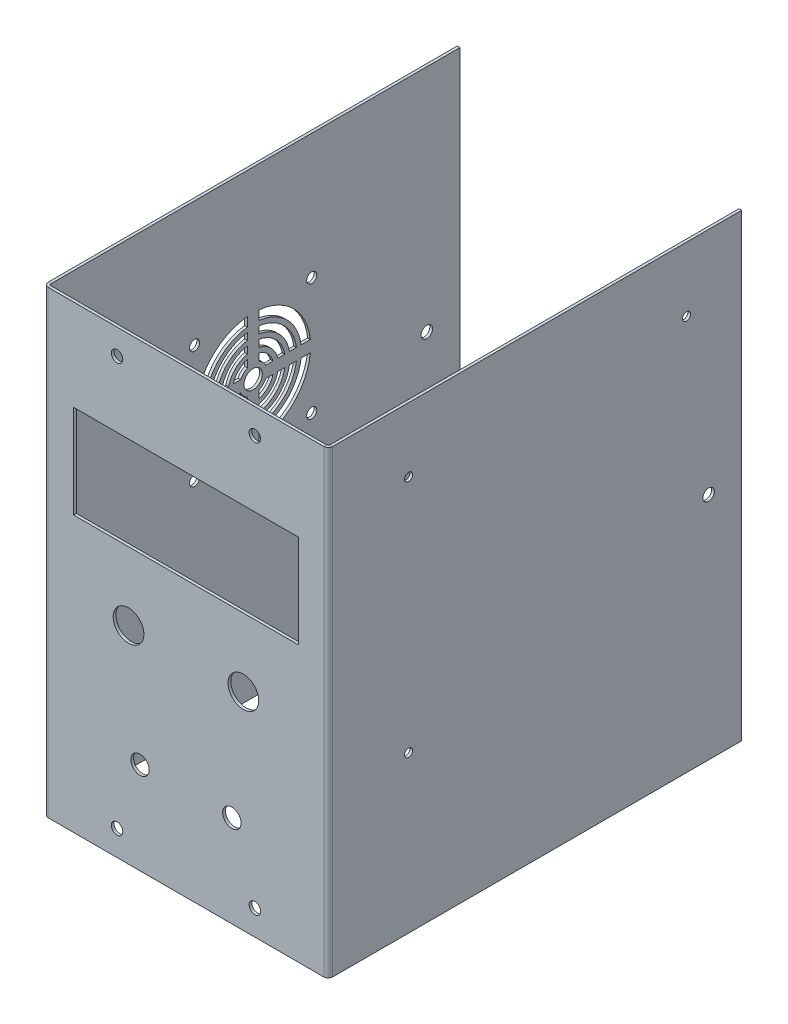
from build123d import *

# Parameters (mm, degrees)
SKETCH1_W               = 120
SKETCH1_H               = 200
BASE_FLANGE1_DEPTH      = 1.2
EDGE_FLANGE1_DEPTH      = 200
EDGE_FLANGE1_BEND_DEPTH = 200
VENT2_START             = -63
VENT2_DEPTH             = 3
SKETCH17_R              = 4
SKETCH17_R_2            = 6.68
CUT_EXTRUDE1_DEPTH      = 10
SKETCH18_R              = 2.5
CUT_EXTRUDE2_DEPTH      = 241.300998248
SKETCH19_R              = 2.5
CUT_EXTRUDE3_DEPTH      = 10
SKETCH20_R              = 2.2
CUT_EXTRUDE4_DEPTH      = 10
SKETCH21_W              = 97.8
SKETCH21_H              = 40.6
CUT_EXTRUDE5_DEPTH      = 10
SKETCH22_R              = 1.75
CUT_EXTRUDE6_DEPTH      = 10


with BuildPart() as part:
    # Base-Flange1: sheet metal written as solids
    # Sketch1 → Base-Flange1 (new body)
    with BuildSketch(Plane.XY):
        Rectangle(SKETCH1_W, SKETCH1_H)
    extrude(amount=-BASE_FLANGE1_DEPTH)

    # Edge-Flange1: sheet metal written as solids
    # Edge-Flange1 section (on a plane across the edge) → Edge-Flange1 (add)
    with BuildSketch(Plane(origin=(60.7366, 100, -1.2), x_dir=(-1, 0, 0), z_dir=(0, -1, 0))):
        with BuildLine():
            Line((-1.2, 0.7366), (-1.2, 178.8))
            Line((-1.2, 178.8), (0, 178.8))
            Line((0, 178.8), (0, 0.7366))
            ThreePointArc((0, 0.7366), (0.215745145, 0.215745145), (0.7366, 0))
            Line((0.7366, 0), (0.7366, -1.2))
            ThreePointArc((0.7366, -1.2), (-0.632782992, -0.632782992), (-1.2, 0.7366))
        make_face()
    extrude(amount=EDGE_FLANGE1_DEPTH)

    # Edge-Flange1 section 2 (on a plane across the edge) → Edge-Flange1 bend (add)
    with BuildSketch(Plane(origin=(-60.7366, -100, -1.2), x_dir=(1, 0, 0), z_dir=(0, 1, 0))):
        with BuildLine():
            Line((-1.2, 0.7366), (-1.2, 178.8))
            Line((-1.2, 178.8), (0, 178.8))
            Line((0, 178.8), (0, 0.7366))
            ThreePointArc((0, 0.7366), (0.215745145, 0.215745145), (0.7366, 0))
            Line((0.7366, 0), (0.7366, -1.2))
            ThreePointArc((0.7366, -1.2), (-0.632782992, -0.632782992), (-1.2, 0.7366))
        make_face()
    extrude(amount=EDGE_FLANGE1_BEND_DEPTH)

    # Vent2: read off the stored shape, not the designer's step
    # Vent2 outline → Vent2 (cut)
    with BuildSketch(Plane.YZ.offset(VENT2_START)):
        with BuildLine():
            add(Edge.make_bspline(
                [(22.499972366, -65.125409409), (23.297481433, -65.205558902), (25.711335631, -65.565787214), (29.628757098, -66.754124024), (33.97878866, -69.079264336), (37.791623213, -72.208376787), (40.920735664, -76.02121134), (43.245875976, -80.371242902), (44.43421289, -84.288664712), (44.794441203, -86.702519272), (44.874590698, -87.500028698)],
                knots=[0.015942024, 0.015942024, 0.015942024, 0.015942024, 0.03125, 0.0625, 0.09375, 0.125, 0.15625, 0.1875, 0.21875, 0.234057983, 0.234057983, 0.234057983, 0.234057983], degree=3))
            Line((22.499972366, -65.125409409), (22.499983292, -69.149413684))
            add(Edge.make_bspline(
                [(22.499983292, -69.149413684), (23.035288652, -69.213578954), (24.926509708, -69.514389274), (28.088155963, -70.47346418), (31.742182475, -72.426582042), (34.944963499, -75.055036501), (37.573417958, -78.257817525), (39.52653582, -81.911844037), (40.48561085, -85.073490703), (40.78642118, -86.964712193), (40.850586469, -87.50001798)],
                knots=[0.018991976, 0.018991976, 0.018991976, 0.018991976, 0.03125, 0.0625, 0.09375, 0.125, 0.15625, 0.1875, 0.21875, 0.231008033, 0.231008033, 0.231008033, 0.231008033], degree=3))
            Line((40.850586469, -87.50001798), (44.874590698, -87.500028698))
        make_face()
        with BuildLine():
            add(Edge.make_bspline(
                [(-4.87459069, -87.500028616), (-4.794441195, -86.702519218), (-4.434212882, -84.288664686), (-3.245875976, -80.371242902), (-0.920735664, -76.02121134), (2.208376787, -72.208376787), (6.02121134, -69.079264336), (10.371242902, -66.754124024), (14.288665029, -65.565787014), (16.702519925, -65.205558699), (17.500029681, -65.125409203)],
                knots=[0.765942017, 0.765942017, 0.765942017, 0.765942017, 0.78125, 0.8125, 0.84375, 0.875, 0.90625, 0.9375, 0.96875, 0.98405799, 0.98405799, 0.98405799, 0.98405799], degree=3))
            Line((-4.87459069, -87.500028616), (-0.850586389, -87.50001731))
            add(Edge.make_bspline(
                [(-0.850586389, -87.50001731), (-0.78642111, -86.964711748), (-0.485610785, -85.073490486), (0.47346418, -81.911844037), (2.426582042, -78.257817525), (5.055036501, -75.055036501), (8.257817525, -72.426582042), (11.911844037, -70.47346418), (15.073490897, -69.514389091), (16.964712592, -69.213578756), (17.500018583, -69.149413459)],
                knots=[0.768991972, 0.768991972, 0.768991972, 0.768991972, 0.78125, 0.8125, 0.84375, 0.875, 0.90625, 0.9375, 0.96875, 0.981008038, 0.981008038, 0.981008038, 0.981008038], degree=3))
            Line((17.500018583, -69.149413459), (17.500029681, -65.125409203))
        make_face()
        with BuildLine():
            add(Edge.make_bspline(
                [(17.500028616, -114.87459069), (16.702519218, -114.794441195), (14.288664686, -114.434212882), (10.371242902, -113.245875976), (6.02121134, -110.920735664), (2.208376787, -107.791623213), (-0.920735664, -103.97878866), (-3.245875976, -99.628757098), (-4.43421289, -95.711335288), (-4.794441203, -93.297480728), (-4.874590698, -92.499971302)],
                knots=[0.515942017, 0.515942017, 0.515942017, 0.515942017, 0.53125, 0.5625, 0.59375, 0.625, 0.65625, 0.6875, 0.71875, 0.734057983, 0.734057983, 0.734057983, 0.734057983], degree=3))
            Line((17.500028616, -114.87459069), (17.50001731, -110.850586388))
            add(Edge.make_bspline(
                [(17.50001731, -110.850586388), (16.964711748, -110.786421109), (15.073490486, -110.485610785), (11.911844037, -109.52653582), (8.257817525, -107.573417958), (5.055036501, -104.944963499), (2.426582042, -101.742182475), (0.47346418, -98.088155963), (-0.48561085, -94.926509297), (-0.78642118, -93.035287808), (-0.850586469, -92.49998202)],
                knots=[0.518991972, 0.518991972, 0.518991972, 0.518991972, 0.53125, 0.5625, 0.59375, 0.625, 0.65625, 0.6875, 0.71875, 0.731008033, 0.731008033, 0.731008033, 0.731008033], degree=3))
            Line((-0.850586469, -92.49998202), (-4.874590698, -92.499971302))
        make_face()
        with BuildLine():
            add(Edge.make_bspline(
                [(44.87459069, -92.499971384), (44.794441195, -93.297480782), (44.434212882, -95.711335314), (43.245875976, -99.628757098), (40.920735664, -103.97878866), (37.791623213, -107.791623213), (33.97878866, -110.920735664), (29.628757098, -113.245875976), (25.711335288, -114.43421289), (23.297480728, -114.794441203), (22.499971302, -114.874590698)],
                knots=[0.265942017, 0.265942017, 0.265942017, 0.265942017, 0.28125, 0.3125, 0.34375, 0.375, 0.40625, 0.4375, 0.46875, 0.484057983, 0.484057983, 0.484057983, 0.484057983], degree=3))
            Line((44.87459069, -92.499971384), (40.850586388, -92.49998269))
            add(Edge.make_bspline(
                [(40.850586388, -92.49998269), (40.786421109, -93.035288252), (40.485610785, -94.926509514), (39.52653582, -98.088155963), (37.573417958, -101.742182475), (34.944963499, -104.944963499), (31.742182475, -107.573417958), (28.088155963, -109.52653582), (24.926509297, -110.48561085), (23.035287808, -110.78642118), (22.49998202, -110.850586469)],
                knots=[0.268991972, 0.268991972, 0.268991972, 0.268991972, 0.28125, 0.3125, 0.34375, 0.375, 0.40625, 0.4375, 0.46875, 0.481008033, 0.481008033, 0.481008033, 0.481008033], degree=3))
            Line((22.49998202, -110.850586469), (22.499971302, -114.874590698))
        make_face()
        with BuildLine():
            Line((17.500019256, -98.64577847), (17.500009439, -95.454350713))
            add(Edge.make_bspline(
                [(17.500009439, -95.454350713), (17.210439413, -95.32160561), (16.58749433, -94.973708422), (15.730010429, -94.269989571), (15.026292586, -93.412506899), (14.678395937, -92.789563358), (14.545651265, -92.499994876)],
                knots=[0.568400752, 0.568400752, 0.568400752, 0.568400752, 0.59375, 0.625, 0.65625, 0.681599122, 0.681599122, 0.681599122, 0.681599122], degree=3))
            Line((14.545651265, -92.499994876), (11.354221815, -92.499981731))
            add(Edge.make_bspline(
                [(17.500019256, -98.64577847), (17.179491053, -98.553088512), (16.307327001, -98.247544554), (14.967636082, -97.531464839), (13.595015643, -96.404984357), (12.468535161, -95.032363918), (11.752455608, -93.692673302), (11.446911715, -92.820509595), (11.354221815, -92.499981731)],
                knots=[0.544798779, 0.544798779, 0.544798779, 0.544798779, 0.5625, 0.59375, 0.625, 0.65625, 0.6875, 0.705201203, 0.705201203, 0.705201203, 0.705201203], degree=3))
        make_face()
        with BuildLine():
            Line((11.35422153, -87.500019256), (14.545649288, -87.500009437))
            add(Edge.make_bspline(
                [(14.545649288, -87.500009437), (14.67839439, -87.210439412), (15.026291578, -86.587494329), (15.730010429, -85.730010429), (16.587493101, -85.026292586), (17.210436642, -84.678395937), (17.500005124, -84.545651265)],
                knots=[0.818400752, 0.818400752, 0.818400752, 0.818400752, 0.84375, 0.875, 0.90625, 0.931599122, 0.931599122, 0.931599122, 0.931599122], degree=3))
            Line((17.500005124, -84.545651265), (17.500018269, -81.354221815))
            add(Edge.make_bspline(
                [(11.35422153, -87.500019256), (11.446911488, -87.179491053), (11.752455446, -86.307327001), (12.468535161, -84.967636082), (13.595015643, -83.595015643), (14.967636082, -82.468535161), (16.307326698, -81.752455608), (17.179490405, -81.446911715), (17.500018269, -81.354221815)],
                knots=[0.794798779, 0.794798779, 0.794798779, 0.794798779, 0.8125, 0.84375, 0.875, 0.90625, 0.9375, 0.955201203, 0.955201203, 0.955201203, 0.955201203], degree=3))
        make_face()
        with BuildLine():
            Line((22.499980744, -81.35422153), (22.499990561, -84.545649287))
            add(Edge.make_bspline(
                [(22.499990561, -84.545649287), (22.789560587, -84.67839439), (23.41250567, -85.026291578), (24.269989571, -85.730010429), (24.973707413, -86.587493101), (25.321604062, -87.210436641), (25.454348735, -87.500005123)],
                knots=[0.068400752, 0.068400752, 0.068400752, 0.068400752, 0.09375, 0.125, 0.15625, 0.181599122, 0.181599122, 0.181599122, 0.181599122], degree=3))
            Line((25.454348735, -87.500005123), (28.645778185, -87.500018269))
            add(Edge.make_bspline(
                [(22.499980744, -81.35422153), (22.820508947, -81.446911488), (23.692672999, -81.752455446), (25.032363918, -82.468535161), (26.404984357, -83.595015643), (27.531464839, -84.967636082), (28.247544392, -86.307326698), (28.553088285, -87.179490405), (28.645778185, -87.500018269)],
                knots=[0.044798779, 0.044798779, 0.044798779, 0.044798779, 0.0625, 0.09375, 0.125, 0.15625, 0.1875, 0.205201203, 0.205201203, 0.205201203, 0.205201203], degree=3))
        make_face()
        with BuildLine():
            Line((28.64577847, -92.499980744), (25.454350713, -92.499990561))
            add(Edge.make_bspline(
                [(25.454350713, -92.499990561), (25.32160561, -92.789560587), (24.973708422, -93.41250567), (24.269989571, -94.269989571), (23.412506899, -94.973707414), (22.789563358, -95.321604063), (22.499994876, -95.454348735)],
                knots=[0.318400752, 0.318400752, 0.318400752, 0.318400752, 0.34375, 0.375, 0.40625, 0.431599122, 0.431599122, 0.431599122, 0.431599122], degree=3))
            Line((22.499994876, -95.454348735), (22.499981731, -98.645778185))
            add(Edge.make_bspline(
                [(28.64577847, -92.499980744), (28.553088512, -92.820508947), (28.247544554, -93.692672999), (27.531464839, -95.032363918), (26.404984357, -96.404984357), (25.032363918, -97.531464839), (23.692673302, -98.247544392), (22.820509595, -98.553088285), (22.499981731, -98.645778185)],
                knots=[0.294798779, 0.294798779, 0.294798779, 0.294798779, 0.3125, 0.34375, 0.375, 0.40625, 0.4375, 0.455201203, 0.455201203, 0.455201203, 0.455201203], degree=3))
        make_face()
        with BuildLine():
            add(Edge.make_bspline(
                [(20, -86), (20.261846381, -86.000014529), (20.785624316, -86.050145571), (21.540195996, -86.281273396), (22.237350899, -86.651395328), (22.846013213, -87.153723892), (23.348500118, -87.762487499), (23.718595562, -88.459506482), (23.949869823, -89.21422335), (24.02505564, -89.999814526), (23.949907601, -90.785586765), (23.718737499, -91.540150756), (23.348607749, -92.237351731), (22.846275284, -92.84601299), (22.237512722, -93.348500178), (21.540493459, -93.718595546), (20.785776666, -93.949869827), (20.00018547, -94.025055639), (19.214413236, -93.949907601), (18.459849244, -93.718737499), (17.76264827, -93.348607749), (17.15398701, -92.846275284), (16.651499822, -92.237512722), (16.281404454, -91.540493459), (16.050130172, -90.785776665), (15.974944362, -90.000185474), (16.050092394, -89.21441322), (16.281262517, -88.459849303), (16.651392191, -87.762648048), (17.153724939, -87.153987836), (17.762486446, -86.65149674), (18.459551818, -86.281393571), (19.214260901, -86.050076915), (19.738058598, -85.999985466), (20, -86)],
                knots=[0, 0, 0, 0, 0.031244329, 0.06249978, 0.093738662, 0.12499978, 0.156238662, 0.18749978, 0.218738662, 0.24999978, 0.281238662, 0.31249978, 0.343738662, 0.37499978, 0.406238662, 0.43749978, 0.468738662, 0.49999978, 0.531238662, 0.56249978, 0.593738662, 0.62499978, 0.656238662, 0.68749978, 0.718738662, 0.74999978, 0.781238662, 0.81249978, 0.843738662, 0.87499978, 0.906238662, 0.93749978, 0.968744333, 1, 1, 1, 1], degree=3))
        make_face()
        with BuildLine():
            Line((22.5, -76.22502813), (22.499992808, -79.287869419))
            add(Edge.make_bspline(
                [(22.499992808, -79.287869419), (23.083519109, -79.424088892), (24.343642182, -79.829001414), (26.150667011, -80.794876308), (27.828314214, -82.171685786), (29.205123692, -83.849332989), (30.170998215, -85.656357123), (30.575910627, -86.916479393), (30.712130047, -87.500004902)],
                knots=[0.036490414, 0.036490414, 0.036490414, 0.036490414, 0.0625, 0.09375, 0.125, 0.15625, 0.1875, 0.213509552, 0.213509552, 0.213509552, 0.213509552], degree=3))
            Line((30.712130047, -87.500004902), (33.77497187, -87.5))
            add(Edge.make_bspline(
                [(22.5, -76.22502813), (22.577209923, -76.239037558), (23.554493564, -76.42487643), (25.392103975, -76.982309454), (27.82812165, -78.284388028), (29.963309, -80.036691), (31.715611972, -82.17187835), (33.017690546, -84.607896025), (33.57512357, -86.445506436), (33.760962442, -87.422790077), (33.77497187, -87.5)],
                knots=[0.02857377, 0.02857377, 0.02857377, 0.02857377, 0.03125, 0.0625, 0.09375, 0.125, 0.15625, 0.1875, 0.21875, 0.22142623, 0.22142623, 0.22142623, 0.22142623], degree=3))
        make_face()
        with BuildLine():
            Line((33.77497187, -92.5), (30.712130581, -92.499992808))
            add(Edge.make_bspline(
                [(30.712130581, -92.499992808), (30.575911108, -93.083519109), (30.170998586, -94.343642182), (29.205123692, -96.150667011), (27.828314214, -97.828314214), (26.150667011, -99.205123692), (24.343642877, -100.170998215), (23.083520607, -100.575910627), (22.499995098, -100.712130047)],
                knots=[0.286490414, 0.286490414, 0.286490414, 0.286490414, 0.3125, 0.34375, 0.375, 0.40625, 0.4375, 0.463509552, 0.463509552, 0.463509552, 0.463509552], degree=3))
            Line((22.499995098, -100.712130047), (22.5, -103.77497187))
            add(Edge.make_bspline(
                [(33.77497187, -92.5), (33.760962442, -92.577209923), (33.57512357, -93.554493564), (33.017690546, -95.392103975), (31.715611972, -97.82812165), (29.963309, -99.963309), (27.82812165, -101.715611972), (25.392103975, -103.017690546), (23.554493564, -103.57512357), (22.577209923, -103.760962442), (22.5, -103.77497187)],
                knots=[0.27857377, 0.27857377, 0.27857377, 0.27857377, 0.28125, 0.3125, 0.34375, 0.375, 0.40625, 0.4375, 0.46875, 0.47142623, 0.47142623, 0.47142623, 0.47142623], degree=3))
        make_face()
        with BuildLine():
            Line((6.22502813, -87.5), (9.287869419, -87.500007192))
            add(Edge.make_bspline(
                [(9.287869419, -87.500007192), (9.424088892, -86.916480891), (9.829001414, -85.656357818), (10.794876308, -83.849332989), (12.171685786, -82.171685786), (13.849332989, -80.794876308), (15.656357123, -79.829001785), (16.916479393, -79.424089373), (17.500004902, -79.287869953)],
                knots=[0.786490414, 0.786490414, 0.786490414, 0.786490414, 0.8125, 0.84375, 0.875, 0.90625, 0.9375, 0.963509552, 0.963509552, 0.963509552, 0.963509552], degree=3))
            Line((17.500004902, -79.287869953), (17.5, -76.22502813))
            add(Edge.make_bspline(
                [(6.22502813, -87.5), (6.239037558, -87.422790077), (6.42487643, -86.445506436), (6.982309454, -84.607896025), (8.284388028, -82.17187835), (10.036691, -80.036691), (12.17187835, -78.284388028), (14.607896025, -76.982309454), (16.445506436, -76.42487643), (17.422790077, -76.239037558), (17.5, -76.22502813)],
                knots=[0.77857377, 0.77857377, 0.77857377, 0.77857377, 0.78125, 0.8125, 0.84375, 0.875, 0.90625, 0.9375, 0.96875, 0.97142623, 0.97142623, 0.97142623, 0.97142623], degree=3))
        make_face()
        with BuildLine():
            Line((17.5, -103.77497187), (17.500007192, -100.712130581))
            add(Edge.make_bspline(
                [(17.500007192, -100.712130581), (16.916480891, -100.575911108), (15.656357818, -100.170998586), (13.849332989, -99.205123692), (12.171685786, -97.828314214), (10.794876308, -96.150667011), (9.829001785, -94.343642877), (9.424089373, -93.083520607), (9.287869953, -92.499995098)],
                knots=[0.536490414, 0.536490414, 0.536490414, 0.536490414, 0.5625, 0.59375, 0.625, 0.65625, 0.6875, 0.713509552, 0.713509552, 0.713509552, 0.713509552], degree=3))
            Line((9.287869953, -92.499995098), (6.22502813, -92.5))
            add(Edge.make_bspline(
                [(17.5, -103.77497187), (17.422790077, -103.760962442), (16.445506436, -103.57512357), (14.607896025, -103.017690546), (12.17187835, -101.715611972), (10.036691, -99.963309), (8.284388028, -97.82812165), (6.982309454, -95.392103975), (6.42487643, -93.554493564), (6.239037558, -92.577209923), (6.22502813, -92.5)],
                knots=[0.52857377, 0.52857377, 0.52857377, 0.52857377, 0.53125, 0.5625, 0.59375, 0.625, 0.65625, 0.6875, 0.71875, 0.72142623, 0.72142623, 0.72142623, 0.72142623], degree=3))
        make_face()
        with BuildLine():
            Line((22.49998599, -71.16524813), (22.499993102, -74.196544366))
            add(Edge.make_bspline(
                [(22.499993102, -74.196544366), (22.707847477, -74.229412404), (23.946163482, -74.45035), (26.162404543, -75.122639376), (28.946424743, -76.610729175), (31.386638857, -78.613361143), (33.389270825, -81.053575257), (34.877360624, -83.837595457), (35.549650188, -86.053837137), (35.770587823, -87.292153792), (35.803455936, -87.500008808)],
                knots=[0.02497021, 0.02497021, 0.02497021, 0.02497021, 0.03125, 0.0625, 0.09375, 0.125, 0.15625, 0.1875, 0.21875, 0.225029809, 0.225029809, 0.225029809, 0.225029809], degree=3))
            Line((35.803455936, -87.500008808), (38.834752084, -87.500015618))
            add(Edge.make_bspline(
                [(22.49998599, -71.16524813), (22.904237129, -71.21888555), (24.534239518, -71.488733614), (27.317855395, -72.333134258), (30.623879382, -74.100240895), (33.521633642, -76.478366358), (35.899759105, -79.376120618), (37.666865742, -82.682144605), (38.511266544, -85.465761002), (38.781114627, -87.095763939), (38.834752084, -87.500015618)],
                knots=[0.021002255, 0.021002255, 0.021002255, 0.021002255, 0.03125, 0.0625, 0.09375, 0.125, 0.15625, 0.1875, 0.21875, 0.228997758, 0.228997758, 0.228997758, 0.228997758], degree=3))
        make_face()
        with BuildLine():
            Line((38.834751938, -92.499985478), (35.803455677, -92.49999283))
            add(Edge.make_bspline(
                [(35.803455677, -92.49999283), (35.770587629, -92.707847297), (35.549650027, -93.946163394), (34.877360624, -96.162404543), (33.389270825, -98.946424743), (31.386638857, -101.386638857), (28.946424743, -103.389270825), (26.162404543, -104.877360624), (23.946162866, -105.549650187), (22.707846216, -105.770587821), (22.499991204, -105.803455934)],
                knots=[0.274970207, 0.274970207, 0.274970207, 0.274970207, 0.28125, 0.3125, 0.34375, 0.375, 0.40625, 0.4375, 0.46875, 0.475029809, 0.475029809, 0.475029809, 0.475029809], degree=3))
            Line((22.499991204, -105.803455934), (22.499984392, -108.834752082))
            add(Edge.make_bspline(
                [(38.834751938, -92.499985478), (38.781114506, -92.904236789), (38.511266436, -94.534239352), (37.666865742, -97.317855395), (35.899759105, -100.623879382), (33.521633642, -103.521633642), (30.623879382, -105.899759105), (27.317855395, -107.666865742), (24.534239001, -108.511266543), (22.904236068, -108.781114626), (22.499984392, -108.834752082)],
                knots=[0.271002251, 0.271002251, 0.271002251, 0.271002251, 0.28125, 0.3125, 0.34375, 0.375, 0.40625, 0.4375, 0.46875, 0.478997758, 0.478997758, 0.478997758, 0.478997758], degree=3))
        make_face()
        with BuildLine():
            Line((1.16524806, -87.500014533), (4.196544321, -87.500007182))
            add(Edge.make_bspline(
                [(4.196544321, -87.500007182), (4.22941237, -87.292152711), (4.450349972, -86.05383661), (5.122639376, -83.837595457), (6.610729175, -81.053575257), (8.613361143, -78.613361143), (11.053575257, -76.610729175), (13.837595457, -75.122639376), (16.053837222, -74.450349786), (17.292153965, -74.229412146), (17.500009068, -74.196544023)],
                knots=[0.774970207, 0.774970207, 0.774970207, 0.774970207, 0.78125, 0.8125, 0.84375, 0.875, 0.90625, 0.9375, 0.96875, 0.975029812, 0.975029812, 0.975029812, 0.975029812], degree=3))
            Line((17.500009068, -74.196544023), (17.500016121, -71.16524785))
            add(Edge.make_bspline(
                [(1.16524806, -87.500014533), (1.218885493, -87.095763218), (1.488733562, -85.465760651), (2.333134258, -82.682144605), (4.100240895, -79.376120618), (6.478366358, -76.478366358), (9.376120618, -74.100240895), (12.682144605, -72.333134258), (15.465761165, -71.488733407), (17.095764273, -71.218885318), (17.500016121, -71.16524785)],
                knots=[0.771002251, 0.771002251, 0.771002251, 0.771002251, 0.78125, 0.8125, 0.84375, 0.875, 0.90625, 0.9375, 0.96875, 0.978997763, 0.978997763, 0.978997763, 0.978997763], degree=3))
        make_face()
        with BuildLine():
            Line((17.500014522, -108.834751938), (17.50000717, -105.803455677))
            add(Edge.make_bspline(
                [(17.50000717, -105.803455677), (17.292152703, -105.770587629), (16.053836606, -105.549650027), (13.837595457, -104.877360624), (11.053575257, -103.389270825), (8.613361143, -101.386638857), (6.610729175, -98.946424743), (5.122639376, -96.162404543), (4.450349813, -93.946162866), (4.229412179, -92.707846216), (4.196544066, -92.499991204)],
                knots=[0.524970207, 0.524970207, 0.524970207, 0.524970207, 0.53125, 0.5625, 0.59375, 0.625, 0.65625, 0.6875, 0.71875, 0.725029809, 0.725029809, 0.725029809, 0.725029809], degree=3))
            Line((4.196544066, -92.499991204), (1.165247918, -92.499984392))
            add(Edge.make_bspline(
                [(17.500014522, -108.834751938), (17.095763211, -108.781114506), (15.465760648, -108.511266436), (12.682144605, -107.666865742), (9.376120618, -105.899759105), (6.478366358, -103.521633642), (4.100240895, -100.623879382), (2.333134258, -97.317855395), (1.488733457, -94.534239001), (1.218885374, -92.904236068), (1.165247918, -92.499984392)],
                knots=[0.521002251, 0.521002251, 0.521002251, 0.521002251, 0.53125, 0.5625, 0.59375, 0.625, 0.65625, 0.6875, 0.71875, 0.728997758, 0.728997758, 0.728997758, 0.728997758], degree=3))
        make_face()
    extrude(amount=VENT2_DEPTH, mode=Mode.SUBTRACT)

    # Sketch17 → Cut-Extrude1 (cut)
    with BuildSketch(Plane.XY):
        with Locations((-20, -60)):
            Circle(SKETCH17_R)
        with Locations((-25, -10)):
            Circle(SKETCH17_R_2)
        with Locations(Location((25, -10, 0), (0, 0, 180))):
            Circle(SKETCH17_R_2)
        with Locations(Location((20, -60, 0), (0, 0, 180))):
            Circle(SKETCH17_R)
    extrude(amount=-CUT_EXTRUDE1_DEPTH, mode=Mode.SUBTRACT)

    # Sketch18 → Cut-Extrude2 (cut, through all)
    with BuildSketch(Plane(origin=(61.9366, 0, 0), x_dir=(0, 0, -1), z_dir=(1, 0, 0))):
        with Locations((165.6, 0)):
            Circle(SKETCH18_R)
    extrude(amount=-CUT_EXTRUDE2_DEPTH, mode=Mode.SUBTRACT)

    # Sketch19 → Cut-Extrude3 (cut)
    with BuildSketch(Plane.XY):
        with Locations((30, -89.0317)):
            Circle(SKETCH19_R)
        with Locations((-30, -89.0317)):
            Circle(SKETCH19_R)
        with Locations((30, 89.0317)):
            Circle(SKETCH19_R)
        with Locations((-30, 89.0317)):
            Circle(SKETCH19_R)
    extrude(amount=-CUT_EXTRUDE3_DEPTH, mode=Mode.SUBTRACT)

    # Sketch20 → Cut-Extrude4 (cut)
    with BuildSketch(Plane.ZY.offset(61.9366)):
        with Locations((-64.5, -5.5)):
            Circle(SKETCH20_R)
        with Locations((-115.5, -5.5)):
            Circle(SKETCH20_R)
        with Locations((-64.5, 45.5)):
            Circle(SKETCH20_R)
        with Locations((-115.5, 45.5)):
            Circle(SKETCH20_R)
    extrude(amount=-CUT_EXTRUDE4_DEPTH, mode=Mode.SUBTRACT)

    # Sketch21 → Cut-Extrude5 (cut)
    with BuildSketch(Plane.XY):
        with Locations((0, 40)):
            Rectangle(SKETCH21_W, SKETCH21_H)
    extrude(amount=-CUT_EXTRUDE5_DEPTH, mode=Mode.SUBTRACT)

    # Sketch22 → Cut-Extrude6 (cut)
    with BuildSketch(Plane(origin=(61.9366, 0, 0), x_dir=(0, 0, -1), z_dir=(1, 0, 0))):
        with Locations((35, -32)):
            Circle(SKETCH22_R)
        with Locations((156, 72)):
            Circle(SKETCH22_R)
        with Locations((35, 72)):
            Circle(SKETCH22_R)
    extrude(amount=-CUT_EXTRUDE6_DEPTH, mode=Mode.SUBTRACT)


solid = part.part
